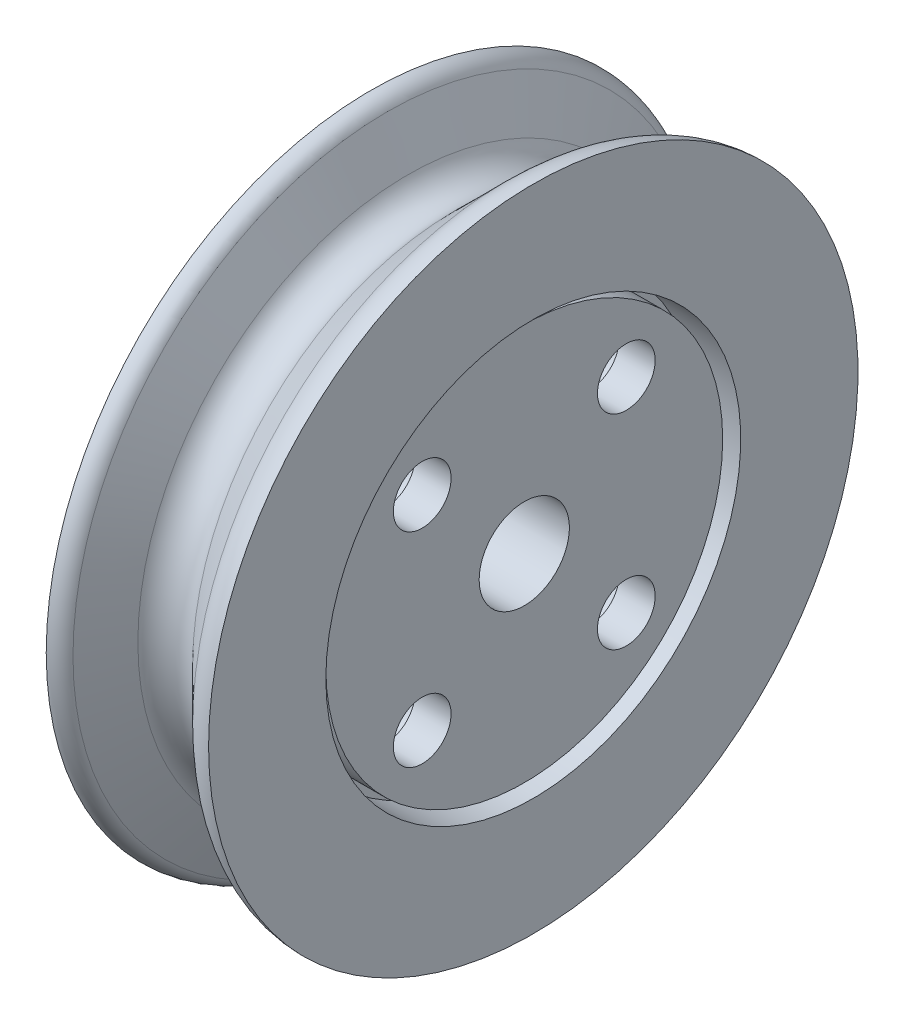
from build123d import *

# Parameters (mm, degrees)
SKETCH2_R          = 1.6
CUT_EXTRUDE1_DEPTH = 20.646882704
CUT_EXTRUDE3_DEPTH = 3
SKETCH5_R          = 1.8
CUT_EXTRUDE4_DEPTH = 28.349588728


with BuildPart() as part:
    # Sketch1 → Revolve1 (revolve)
    with BuildSketch(Plane(origin=(0, 0, 0), x_dir=(1, 0, 0), z_dir=(0, 1, 0))):
        Polygon((0, 5), (10, 5), (10, 11), (12, 11), (12, 2.5), (0, 2.5), align=None)
    revolve(axis=Axis((0, 0, 0), (1, 0, 0)))

    # Sketch2 → Cut-Extrude1 (cut, through all)
    with BuildSketch(Plane(origin=(12, 0, 0), x_dir=(0, 0, -1), z_dir=(1, 0, 0))):
        with Locations((-5.656854249, 5.656854249)):
            Circle(SKETCH2_R)
        with Locations((-5.656854249, -5.656854249)):
            Circle(SKETCH2_R)
        with Locations((5.656854249, -5.656854249)):
            Circle(SKETCH2_R)
        with Locations((5.656854249, 5.656854249)):
            Circle(SKETCH2_R)
    extrude(amount=-CUT_EXTRUDE1_DEPTH, mode=Mode.SUBTRACT)


with BuildPart() as body_2:
    # Sketch3 → Revolve2 (revolve)
    with BuildSketch(Plane(origin=(0, 0, 0), x_dir=(1, 0, 0), z_dir=(0, 1, 0))):
        with BuildLine():
            Line((10, 5), (10, 11.5))
            Line((10, 11.5), (12.5, 11.5))
            Line((12.5, 11.5), (12.5, 18))
            ThreePointArc((12.5, 18), (11.683652474, 17.837618381), (10.991586459, 17.375194654))
            Line((10.991586459, 17.375194654), (8.13137085, 14.514979045))
            ThreePointArc((8.13137085, 14.514979045), (6.722162916, 14.07065749), (5.549907541, 14.970160676))
            Line((5.549907541, 14.970160676), (4.406307787, 17.422618262))
            ThreePointArc((4.406307787, 17.422618262), (4.037299608, 17.843391446), (3.5, 18))
            Line((3.5, 18), (3.5, 5.5))
            Line((3.5, 5.5), (4, 5))
            Line((4, 5), (10, 5))
        make_face()
    revolve(axis=Axis((0, 0, 0), (1, 0, 0)))

    # Sketch4 → Cut-Extrude3 (cut, symmetric)
    with BuildSketch(Plane.XY):
        with BuildLine():
            Line((7, 0), (3.5, 0))
            Line((3.5, 0), (3.5, 14))
            ThreePointArc((3.5, 14), (5.921788891, 7.167947223), (7, 0))
        make_face()
    cut_extrude3 = extrude(amount=CUT_EXTRUDE3_DEPTH, both=True, mode=Mode.SUBTRACT)

    # Mirror1: Cut-Extrude3 across plane
    add(cut_extrude3.mirror(Plane.ZX), mode=Mode.SUBTRACT)

    # Sketch5 → Cut-Extrude4 (cut, through all)
    with BuildSketch(Plane(origin=(10, 0, 0), x_dir=(0, 0, -1), z_dir=(1, 0, 0))):
        with Locations((-5.656854249, 5.656854249)):
            Circle(SKETCH5_R)
        with Locations((5.656854249, 5.656854249)):
            Circle(SKETCH5_R)
        with Locations((5.656854249, -5.656854249)):
            Circle(SKETCH5_R)
        with Locations((-5.656854249, -5.656854249)):
            Circle(SKETCH5_R)
    extrude(amount=-CUT_EXTRUDE4_DEPTH, mode=Mode.SUBTRACT)


solid = Compound([part.part, body_2.part])
